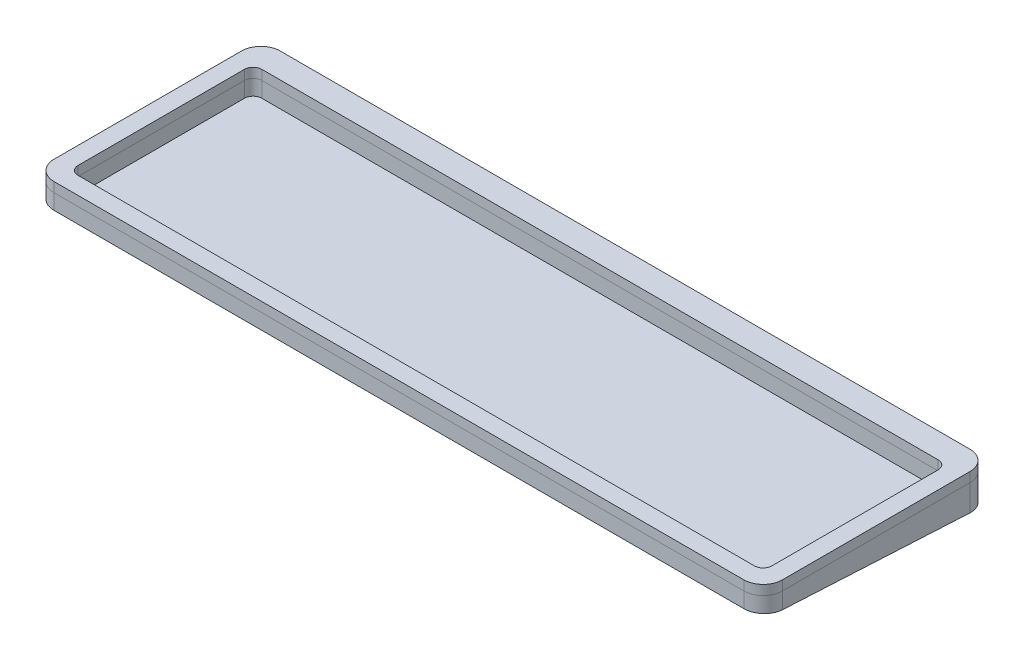
from build123d import *

# Parameters (mm, degrees)
BOSS_EXTRUDE1_DEPTH = 13
SKETCH4_W           = 377.65
SKETCH4_H           = 117.25
BOSS_EXTRUDE3_DEPTH = 10.5
CUT_EXTRUDE4_DEPTH  = 400
FILLET1_R           = 10
FILLET2_R           = 4.5


with BuildPart() as part:
    # Sketch2 → Boss-Extrude1 (new body)
    with BuildSketch(Plane(origin=(0, 0, 0), x_dir=(1, 0, 0), z_dir=(0, 1, 0))):
        Polygon((-188.825, 60.625), (-188.825, 54.625), (-188.825, -56.625), (188.825, -56.625), (188.825, 60.625), (-182.825, 60.625), align=None)
        Polygon((-179.825, -46.625), (-179.825, 46.625), (-179.825, 47.625), (-178.825, 47.625), (178.825, 47.625), (179.825, 47.625), (179.825, 46.625), (179.825, -46.625), (179.825, -47.625), (178.825, -47.625), (-178.825, -47.625), (-179.825, -47.625), align=None, mode=Mode.SUBTRACT)
    extrude(amount=BOSS_EXTRUDE1_DEPTH)

    # Sketch4 → Boss-Extrude3 (add)
    with BuildSketch(Plane.XZ):
        with Locations((0, -2)):
            Rectangle(SKETCH4_W, SKETCH4_H)
    extrude(amount=BOSS_EXTRUDE3_DEPTH)

    # Sketch8 → Cut-Extrude4 (cut)
    with BuildSketch(Plane.ZY.offset(188.825)):
        Polygon((-60.625, -6.100802306), (-60.625, -10.5), (56.625, -10.5), (56.625, 0.044009815), align=None)
    extrude(amount=-CUT_EXTRUDE4_DEPTH, mode=Mode.SUBTRACT)

    # Fillet1
    fillet1_edges = [part.edges().sort_by_distance(p)[0] for p in [
        (188.825, 6.522004907, 56.625),
        (-188.825, 6.522004907, 56.625),
        (188.825, 3.449598847, -60.625),
        (-188.825, 3.449598847, -60.625),
    ]]
    fillet(fillet1_edges, radius=FILLET1_R)

    # Fillet2
    fillet2_edges = [part.edges().sort_by_distance(p)[0] for p in [
        (179.825, 6.5, 47.625),
        (-179.825, 6.5, 47.625),
        (179.825, 6.5, -47.625),
        (-179.825, 6.5, -47.625),
    ]]
    fillet(fillet2_edges, radius=FILLET2_R)


with BuildPart() as body_2:
    # Split1: the piece on the far side of the plane
    add(part.part)
    split(bisect_by=Plane.ZX.offset(8), keep=Keep.BOTTOM)


with BuildPart() as part_1:
    add(part.part)

    # Split1
    split(bisect_by=Plane.ZX.offset(8), keep=Keep.TOP)


solid = Compound([body_2.part, part_1.part])
